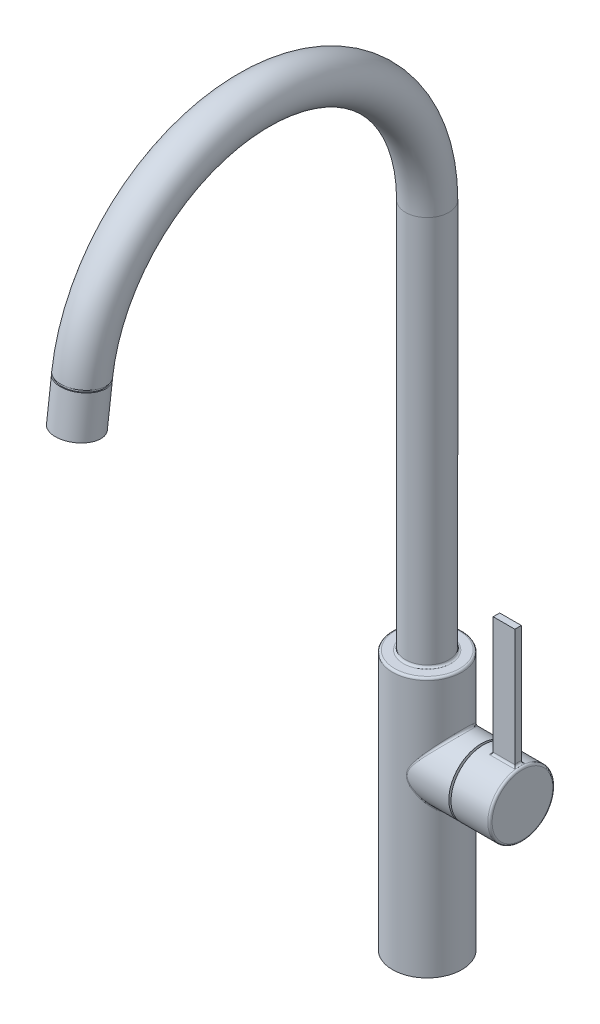
from build123d import *

# Parameters (mm, degrees)
SKETCH_1_R           = 16
EXTRUSION_1_DEPTH    = 120
SKETCH_2_R           = 10
SKETCH_2_R_2         = 9
EXTRUDED_START       = 1
SKETCH_4_R           = 10
SKETCH_4_R_2         = 9.5
EXTRUDED_CUT_1_DEPTH = 1
FILLET_1_R           = 1
SKETCH5_R            = 15
BOSS_EXTRUDE1_DEPTH  = 20
SKETCH6_R            = 13
BOSS_EXTRUDE2_DEPTH  = 1
SKETCH7_R            = 15
BOSS_EXTRUDE3_DEPTH  = 18
SKETCH8_W            = 10
SKETCH8_H            = 3
BOSS_EXTRUDE4_DEPTH  = 65
FILLET1_R            = 1


with BuildPart() as part:
    # Sketch 1 → Extrusion 1 (new body)
    with BuildSketch(Plane(origin=(0, 0, 0), x_dir=(1, 0, 0), z_dir=(0, 1, 0))):
        with Locations(Location((0, 0, 0), (0, 0, 270))):
            Circle(SKETCH_1_R)
    extrude(amount=EXTRUSION_1_DEPTH)

    # Swept Boss/Base 1: sweep along a path in Sketch 3
    with BuildLine(Plane(origin=(0, 0, 0), x_dir=(0, 0, -1), z_dir=(1, 0, 0))) as swept_boss_base_1_path:
        Line((0, 120), (0, 300))
        ThreePointArc((0, 300), (-75.116116837, 379.850783874), (-159.403692131, 309.749547472))
        Line((-159.403692131, 309.749547472), (-161.841078999, 289.89862444))
    # Sketch 2 → Swept Boss/Base 1 (sweep)
    with BuildSketch(Plane(origin=(0, 120, 0), x_dir=(1, 0, 0), z_dir=(0, 1, 0))):
        Circle(SKETCH_2_R)
        Circle(SKETCH_2_R_2, mode=Mode.SUBTRACT)
    sweep(path=swept_boss_base_1_path.line)

    # Sketch 4 → Extruded Cut 1 (cut)
    with BuildSketch(Plane(origin=(0, 285.867483117, -35.100113391), x_dir=(-1, 0, 0), z_dir=(0, -0.9925461516413215, 0.12186934340515151)).offset(EXTRUDED_START)):
        with Locations(Location((0, -195.964495153, 0), (0, 0, 90))):
            Circle(SKETCH_4_R)
        with Locations(Location((0, -195.964495153, 0), (0, 0, 270))):
            Circle(SKETCH_4_R_2, mode=Mode.SUBTRACT)
    extrude(amount=-EXTRUDED_CUT_1_DEPTH, mode=Mode.SUBTRACT)

    # Fillet 1
    fillet_1_edges = [part.edges().sort_by_distance(p)[0] for p in [
        (0, 120, -16),
    ]]
    fillet(fillet_1_edges, radius=FILLET_1_R)

    # Sketch5 → Boss-Extrude1 (add)
    with BuildSketch(Plane(origin=(5, 0, 0), x_dir=(0, 0, -1), z_dir=(1, 0, 0))):
        with Locations(Location((0, 80, 0), (0, 0, 180))):
            Circle(SKETCH5_R)
    extrude(amount=BOSS_EXTRUDE1_DEPTH)

    # Sketch6 → Boss-Extrude2 (add)
    with BuildSketch(Plane(origin=(25, 0, 0), x_dir=(0, 0, -1), z_dir=(1, 0, 0))):
        with Locations((0, 80)):
            Circle(SKETCH6_R)
    extrude(amount=BOSS_EXTRUDE2_DEPTH)

    # Sketch7 → Boss-Extrude3 (add)
    with BuildSketch(Plane(origin=(26, 0, 0), x_dir=(0, 0, -1), z_dir=(1, 0, 0))):
        with Locations(Location((0, 80, 0), (0, 0, 180))):
            Circle(SKETCH7_R)
    extrude(amount=BOSS_EXTRUDE3_DEPTH)

    # Sketch8 → Boss-Extrude4 (add)
    with BuildSketch(Plane(origin=(0, 85, 0), x_dir=(1, 0, 0), z_dir=(0, 1, 0))):
        with Locations((37, 0)):
            Rectangle(SKETCH8_W, SKETCH8_H)
    extrude(amount=BOSS_EXTRUDE4_DEPTH)

    # Fillet1
    fillet1_edges = [part.edges().sort_by_distance(p)[0] for p in [
        (5.567772293, 80.00939687, -14.999997057),
        (44, 80, -15),
        (37, 94.924811557, 1.5),
        (32, 95, 0),
        (37, 94.924811557, -1.5),
        (42, 95, 0),
        (-10, 120, 0),
    ]]
    fillet(fillet1_edges, radius=FILLET1_R - 0.0001)  # a hair under: the kernel refuses the full size


solid = part.part
